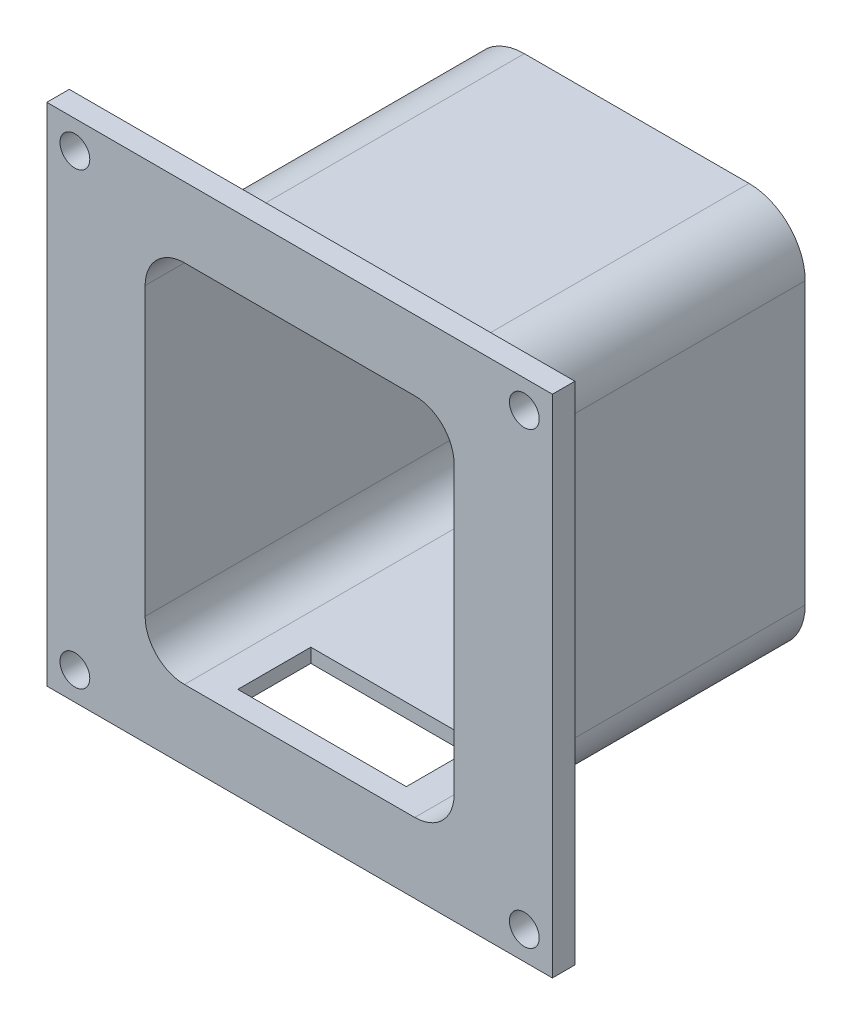
from build123d import *

# Parameters (mm, degrees)
SKETCH1_W           = 60
SKETCH1_H           = 70
BOSS_EXTRUDE1_DEPTH = 60
SKETCH2_R           = 1.25
BOSS_EXTRUDE2_DEPTH = 4
SKETCH4_W           = 30
SKETCH4_H           = 17
CUT_EXTRUDE1_DEPTH  = 2.5
SKETCH5_R           = 2.25
CUT_EXTRUDE2_DEPTH  = 2.5
SKETCH6_W           = 90
SKETCH6_H           = 90
SKETCH6_R           = 2.65
BOSS_EXTRUDE3_DEPTH = 4
FILLET1_R           = 10
CUT_EXTRUDE5_DEPTH  = 85.77027781
FILLET3_R           = 5
FILLET4_R           = 5


with BuildPart() as part:
    # Sketch1 → Boss-Extrude1 (new body)
    with BuildSketch(Plane.XY):
        Rectangle(SKETCH1_W, SKETCH1_H)
        with BuildLine():
            Line((20.5, -32.5), (-20.5, -32.5))
            ThreePointArc((-20.5, -32.5), (-25.449747468, -30.449747468), (-27.5, -25.5))
            Line((-27.5, -25.5), (-27.5, 25.5))
            ThreePointArc((-27.5, 25.5), (-25.449747468, 30.449747468), (-20.5, 32.5))
            Line((-20.5, 32.5), (20.5, 32.5))
            ThreePointArc((20.5, 32.5), (25.449747468, 30.449747468), (27.5, 25.5))
            Line((27.5, 25.5), (27.5, -25.5))
            ThreePointArc((27.5, -25.5), (25.449747468, -30.449747468), (20.5, -32.5))
        make_face(mode=Mode.SUBTRACT)
    extrude(amount=BOSS_EXTRUDE1_DEPTH)

    # Sketch2 → Boss-Extrude2 (add)
    with BuildSketch(Plane(origin=(0, 0, 0), x_dir=(-1, 0, 0), z_dir=(0, 0, -1))):
        with BuildLine():
            Line((-17.65, -4.5), (-10.65, -4.5))
            Line((-10.65, -4.5), (-10.65, -27.5))
            Line((-10.65, -27.5), (10.65, -27.5))
            Line((10.65, -27.5), (10.65, -4.5))
            Line((10.65, -4.5), (17.65, -4.5))
            Line((17.65, -4.5), (17.65, -25.5))
            Line((17.65, -25.5), (27.5, -25.5))
            ThreePointArc((27.5, -25.5), (25.449747468, -30.449747468), (20.5, -32.5))
            Line((20.5, -32.5), (-20.5, -32.5))
            ThreePointArc((-20.5, -32.5), (-25.449747468, -30.449747468), (-27.5, -25.5))
            Line((-27.5, -25.5), (-17.65, -25.5))
            Line((-17.65, -25.5), (-17.65, -4.5))
        make_face()
        with Locations((13.5, -8.5)):
            Circle(SKETCH2_R, mode=Mode.SUBTRACT)
        with Locations((13.5, -16.5)):
            Circle(SKETCH2_R, mode=Mode.SUBTRACT)
        with Locations((13.5, -24.5)):
            Circle(SKETCH2_R, mode=Mode.SUBTRACT)
        with Locations(Location((-13.5, -8.5, 0), (0, 0, 180))):
            Circle(SKETCH2_R, mode=Mode.SUBTRACT)
        with Locations(Location((-13.5, -16.5, 0), (0, 0, 180))):
            Circle(SKETCH2_R, mode=Mode.SUBTRACT)
        with Locations(Location((-13.5, -24.5, 0), (0, 0, 180))):
            Circle(SKETCH2_R, mode=Mode.SUBTRACT)
    extrude(amount=-BOSS_EXTRUDE2_DEPTH)

    # Sketch4 → Cut-Extrude1 (cut)
    with BuildSketch(Plane.XZ.offset(35)):
        with Locations((0, 51.5)):
            Rectangle(SKETCH4_W, SKETCH4_H)
    extrude(amount=-CUT_EXTRUDE1_DEPTH, mode=Mode.SUBTRACT)

    # Sketch5 → Cut-Extrude2 (cut)
    with BuildSketch(Plane(origin=(0, 0, 0), x_dir=(-1, 0, 0), z_dir=(0, 0, -1))):
        with Locations((-13.5, -8.5)):
            Circle(SKETCH5_R)
        with Locations((-13.5, -16.5)):
            Circle(SKETCH5_R)
        with Locations((-13.5, -24.5)):
            Circle(SKETCH5_R)
        with Locations((13.5, -24.5)):
            Circle(SKETCH5_R)
        with Locations((13.5, -16.5)):
            Circle(SKETCH5_R)
        with Locations((13.5, -8.5)):
            Circle(SKETCH5_R)
    extrude(amount=-CUT_EXTRUDE2_DEPTH, mode=Mode.SUBTRACT)

    # Sketch6 → Boss-Extrude3 (add)
    with BuildSketch(Plane.XY.offset(60)):
        Rectangle(SKETCH6_W, SKETCH6_H)
        with Locations((40, 40)):
            Circle(SKETCH6_R, mode=Mode.SUBTRACT)
        with Locations((-40, 40)):
            Circle(SKETCH6_R, mode=Mode.SUBTRACT)
        with Locations((-40, -40)):
            Circle(SKETCH6_R, mode=Mode.SUBTRACT)
        with Locations((40, -40)):
            Circle(SKETCH6_R, mode=Mode.SUBTRACT)
    extrude(amount=-BOSS_EXTRUDE3_DEPTH)

    # Fillet1
    fillet1_edges = [part.edges().sort_by_distance(p)[0] for p in [
        (-30, -35, 28),
        (30, -35, 28),
        (-30, 35, 28),
        (30, 35, 28),
    ]]
    fillet(fillet1_edges, radius=FILLET1_R)

    # Sketch8 → Cut-Extrude5 (cut, through all)
    with BuildSketch(Plane(origin=(0, 0, 56), x_dir=(-1, 0, 0), z_dir=(0, 0, -1))):
        with BuildLine():
            Line((-20.5, 32.5), (20.5, 32.5))
            ThreePointArc((20.5, 32.5), (25.449747468, 30.449747468), (27.5, 25.5))
            Line((27.5, 25.5), (27.5, -25.5))
            ThreePointArc((27.5, -25.5), (25.449747468, -30.449747468), (20.5, -32.5))
            Line((20.5, -32.5), (-20.5, -32.5))
            ThreePointArc((-20.5, -32.5), (-25.449747468, -30.449747468), (-27.5, -25.5))
            Line((-27.5, -25.5), (-27.5, 25.5))
            ThreePointArc((-27.5, 25.5), (-25.449747468, 30.449747468), (-20.5, 32.5))
        make_face()
    extrude(amount=-CUT_EXTRUDE5_DEPTH, mode=Mode.SUBTRACT)

    # Fillet3
    fillet3_edges = [part.edges().sort_by_distance(p)[0] for p in [
        (17.65, -25.5, 2),
        (-17.65, -25.5, 2),
    ]]
    fillet(fillet3_edges, radius=FILLET3_R)

    # Fillet4
    # the kernel refuses this fillet: 5 mm, written as the material it adds along each edge
    with BuildSketch(Plane(origin=(-27.5, -25.5, 0), x_dir=(1, 0, 0), z_dir=(0, 0, 1))) as fillet4_piece_1:
        with BuildLine():
            CenterArc((5, 4.997749494), FILLET4_R, 180, 88.280868679)
            Line((0, 4.997749494), (-0.1, 4.997749494))
            Line((-0.1, 4.997749494), (-0.1, 0))
            Line((-0.1, 0), (0, -0.1))
            ThreePointArc((0, -0.1), (2.425, -0.1), (4.847, -0.09995499))
            Line((4.847, -0.09995499), (4.85, 0))
        make_face()
    extrude(amount=4)
    with BuildSketch(Plane(origin=(27.5, -25.5, 0), x_dir=(0, 1, 0), z_dir=(0, 0, 1))) as fillet4_piece_2:
        with BuildLine():
            CenterArc((4.997749494, 5), FILLET4_R, 181.719131321, 88.280868679)
            Line((0, 4.85), (-0.09995499, 4.847))
            ThreePointArc((-0.09995499, 4.847), (-0.1, 2.425), (-0.1, 0))
            Line((-0.1, 0), (0, -0.1))
            Line((0, -0.1), (4.997749494, -0.1))
            Line((4.997749494, -0.1), (4.997749494, 0))
        make_face()
    extrude(amount=4)


solid = part.part
